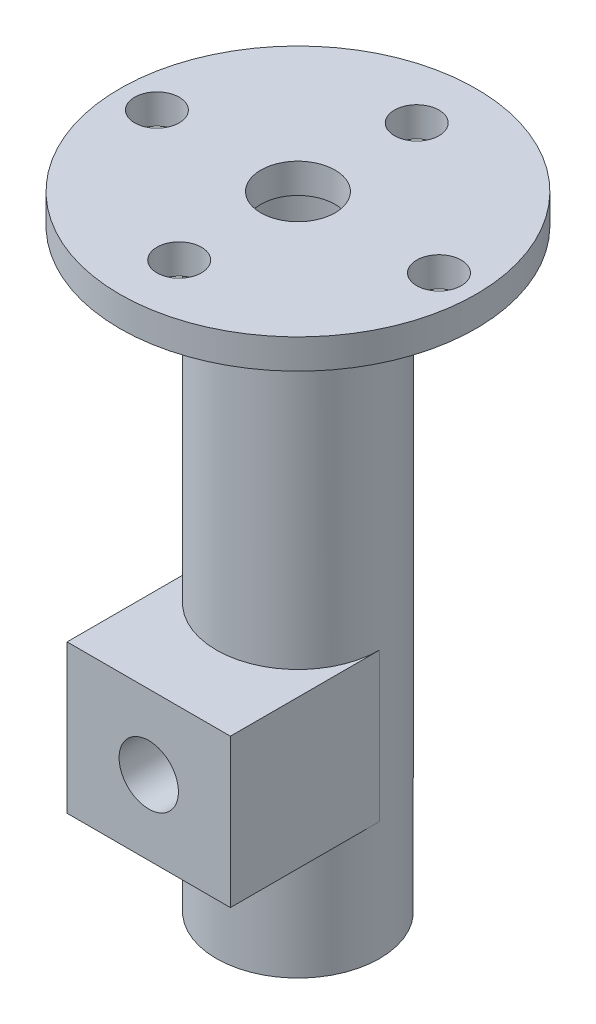
from build123d import *

# Parameters (mm, degrees)
SKETCH1_R                = 16
SKETCH1_R_2              = 14
BOSS_EXTRUDE1_DEPTH      = 26
SKETCH2_R                = 16
BOSS_EXTRUDE2_DEPTH      = 2
SKETCH3_R                = 1.5
CUT_EXTRUDE1_DEPTH       = 2
CUT_EXTRUDE2_DEPTH       = 26
SKETCH5_R                = 2.5
CUT_EXTRUDE3_DEPTH       = 10
SKETCH9_R                = 22.610796359
SKETCH9_R_2              = 12
CUT_EXTRUDE4_DEPTH       = 44
SKETCH10_R               = 5.5
SKETCH10_R_2             = 4.05
BOSS_EXTRUDE3_DEPTH      = 40
BOSS_EXTRUDE4_DEPTH      = 6
BOSS_EXTRUDE4_DEPTH_BACK = 4.05
SKETCH13_W               = 11
SKETCH13_H               = 10
SKETCH13_R               = 2
CUT_EXTRUDE5_START       = -33
SKETCH14_R               = 4.05
CUT_EXTRUDE5_DEPTH       = 33
CUT_EXTRUDE6_START       = -10
SKETCH15_R               = 2
CUT_EXTRUDE6_DEPTH       = 10
CHAMFER3_SIZE            = 1


with BuildPart() as part:
    # Sketch1 → Boss-Extrude1 (new body)
    with BuildSketch(Plane(origin=(0, 0, 0), x_dir=(1, 0, 0), z_dir=(0, 1, 0))):
        with Locations(Location((0, 0, 0), (0, 0, 90))):
            Circle(SKETCH1_R)
        with Locations(Location((0, 0, 0), (0, 0, 90))):
            Circle(SKETCH1_R_2, mode=Mode.SUBTRACT)
    extrude(amount=BOSS_EXTRUDE1_DEPTH)

    # Sketch2 → Boss-Extrude2 (add)
    with BuildSketch(Plane(origin=(0, 26, 0), x_dir=(1, 0, 0), z_dir=(0, 1, 0))):
        with Locations(Location((0, 0, 0), (0, 0, 90))):
            Circle(SKETCH2_R)
    extrude(amount=BOSS_EXTRUDE2_DEPTH)

    # Sketch3 → Cut-Extrude1 (cut)
    with BuildSketch(Plane.XZ.offset(-26)):
        with Locations(Location((0, 8, 0), (0, 0, 270))):
            Circle(SKETCH3_R)
        with Locations(Location((9.5, 0, 0), (0, 0, 270))):
            Circle(SKETCH3_R)
        with Locations(Location((-9.5, 0, 0), (0, 0, 270))):
            Circle(SKETCH3_R)
        with Locations(Location((0, -8, 0), (0, 0, 270))):
            Circle(SKETCH3_R)
    extrude(amount=-CUT_EXTRUDE1_DEPTH, mode=Mode.SUBTRACT)

    # Sketch4 → Cut-Extrude2 (cut)
    with BuildSketch(Plane.XZ):
        Polygon((-0.813172798, -5.550788232), (5.550788232, 0.813172798), (16.15738995, -9.793428919), (9.793428919, -16.15738995), align=None)
    extrude(amount=-CUT_EXTRUDE2_DEPTH, mode=Mode.SUBTRACT)

    # Sketch5 → Cut-Extrude3 (cut)
    with BuildSketch(Plane.XZ.offset(-26)):
        with Locations(Location((0, 0, 0), (0, 0, 270))):
            Circle(SKETCH5_R)
    extrude(amount=-CUT_EXTRUDE3_DEPTH, mode=Mode.SUBTRACT)

    # Sketch9 → Cut-Extrude4 (cut)
    with BuildSketch(Plane.XZ):
        Circle(SKETCH9_R)
        with Locations(Location((0, 0, 0), (0, 0, 90))):
            Circle(SKETCH9_R_2, mode=Mode.SUBTRACT)
    extrude(amount=-CUT_EXTRUDE4_DEPTH, mode=Mode.SUBTRACT)

    # Sketch10 → Boss-Extrude3 (add)
    with BuildSketch(Plane.XZ.offset(-26)):
        with Locations(Location((0, 0, 0), (0, 0, 90))):
            Circle(SKETCH10_R)
        with Locations(Location((0, 0, 0), (0, 0, 270))):
            Circle(SKETCH10_R_2, mode=Mode.SUBTRACT)
    extrude(amount=BOSS_EXTRUDE3_DEPTH)

    # Sketch13 → Boss-Extrude4 (add, two sides: drawn at the far end of the back side and taken through both)
    with BuildSketch(Plane.XY.offset(4.05).offset(-BOSS_EXTRUDE4_DEPTH_BACK)):
        with Locations((0, -1)):
            Rectangle(SKETCH13_W, SKETCH13_H)
        with Locations((0, -1)):
            Circle(SKETCH13_R, mode=Mode.SUBTRACT)
    extrude(amount=BOSS_EXTRUDE4_DEPTH + BOSS_EXTRUDE4_DEPTH_BACK)

    # Sketch14 → Cut-Extrude5 (cut)
    with BuildSketch(Plane.XZ.offset(14).offset(CUT_EXTRUDE5_START)):
        with Locations(Location((0, 0, 0), (0, 0, 270))):
            Circle(SKETCH14_R)
    extrude(amount=CUT_EXTRUDE5_DEPTH, mode=Mode.SUBTRACT)

    # Sketch15 → Cut-Extrude6 (cut)
    with BuildSketch(Plane.XY.offset(10.05).offset(CUT_EXTRUDE6_START)):
        with Locations((0, -1)):
            Circle(SKETCH15_R)
    extrude(amount=CUT_EXTRUDE6_DEPTH, mode=Mode.SUBTRACT)

    # Chamfer3
    chamfer3_edges = [part.edges().sort_by_distance(p)[0] for p in [
        (0, 26, -5.5),
    ]]
    chamfer(chamfer3_edges, length=CHAMFER3_SIZE - 0.0001)  # a hair under: the kernel refuses the full size


solid = part.part
